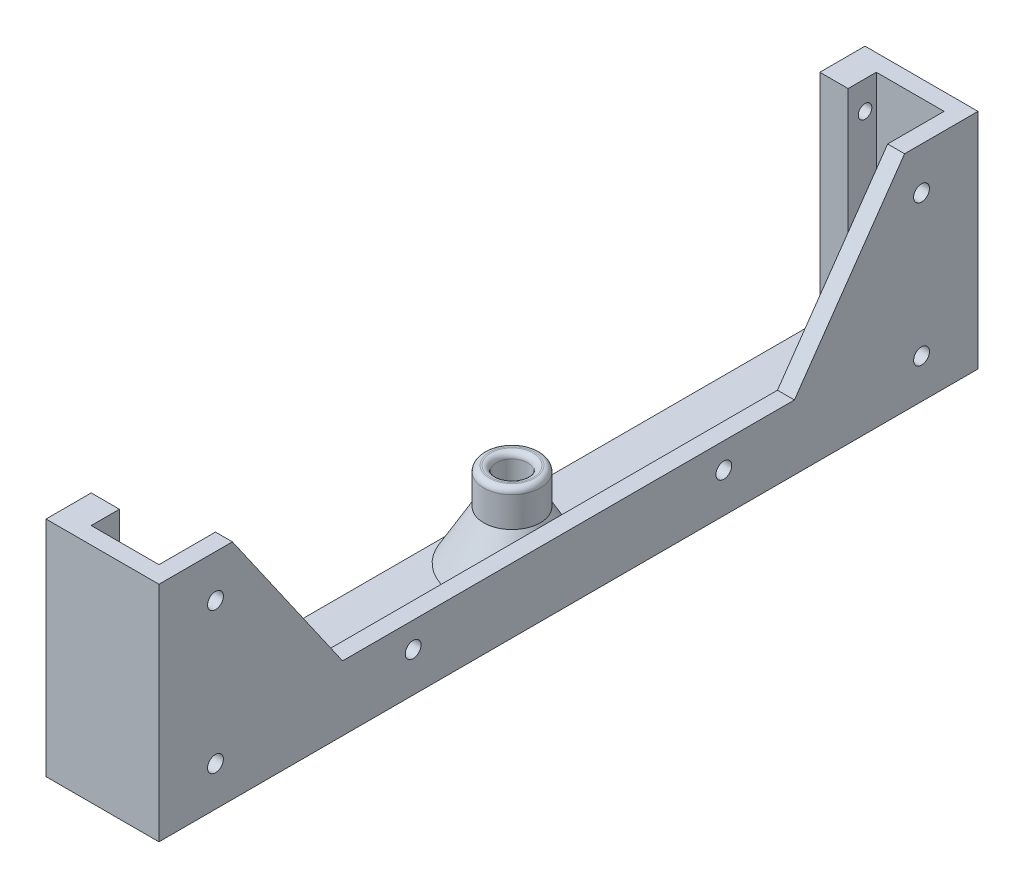
from build123d import *
from OCP.BRepFilletAPI import BRepFilletAPI_MakeChamfer

# Parameters (mm, degrees)
EXTRUDE_1_DEPTH           = 4
SKETCH_2_W                = 6
SKETCH_2_H                = 290
EXTRUDE_2_DEPTH           = 80
EXTRUDE_1_2_DEPTH         = 96
SKETCH_29_W               = 8
SKETCH_29_H               = 100
EXTRUDE_5_DEPTH           = 96
SKETCH_20_W               = 6
SKETCH_20_H               = 7.125217771
SKETCH_20_W_2             = 7.125217771
SKETCH_20_H_2             = 6
SKETCH_20_H_3             = 7.251760651
SKETCH_20_W_3             = 7.251760651
CUT_EXTRUDE_7_DEPTH       = 2
CUT_EXTRUDE_6_DEPTH       = 197.012754687
CUT_EXTRUDE_6_DEPTH_BACK  = 197.012754687
SKETCH_16_R               = 2.8
SKETCH_21_R               = 2
LED_DEPTH                 = 10
SKETCH_22_W               = 46
SKETCH_22_H               = 290
CUT_EXTRUDE_9_DEPTH       = 20
FILLET_3_R                = 30
SKETCH_23_W               = 30
SKETCH_23_H               = 6
EXTRUDE_3_DEPTH           = 10
SKETCH_24_W               = 30
SKETCH_24_H               = 6
EXTRUDE_4_DEPTH           = 10
CHAMFER_1_SIZE            = 10
CUT_EXTRUDE_10_DEPTH      = 10
CHAMFER_2_SIZE            = 2
SKETCH_30_R               = 1.9
CUT_EXTRUDE_11_DEPTH      = 7
SKETCH_32_R               = 1.9
CUT_EXTRUDE_13_DEPTH      = 7
CHAMFER_3_SIZE            = 2
CHAMFER_4_SIZE            = 2
CHAMFER_5_SIZE            = 2
SKETCH_33_R               = 10
EXTRUDE_6_DEPTH           = 30
CHAMFER_6_SIZE            = 10
CHAMFER_6_SIZE_2          = 17.320508076
CUT_EXTRUDE_14_DEPTH      = 171.238068672
CUT_EXTRUDE_14_DEPTH_BACK = 171.238068672
SKETCH_34_R               = 5.5
FILLET_4_R                = 2
CUT_EXTRUDE_15_DEPTH      = 187.077940745
CUT_EXTRUDE_15_DEPTH_BACK = 187.077940745
SKETCH_35_W               = 74.138767557
SKETCH_35_H               = 312.299593446
SKETCH_36_W               = 10
SKETCH_36_H               = 10
EXTRUDE_7_DEPTH           = 76
SKETCH_37_R               = 2.4
CUT_EXTRUDE_16_DEPTH      = 20
CHAMFER_7_SIZE            = 1
CHAMFER_7_SIZE2           = 1.732050808


# Some blends are built 0.0001 mm under size
with BuildPart() as part:
    # Эскиз1 → Extrude 1 (new body)
    with BuildSketch(Plane(origin=(0, 0, 0), x_dir=(1, 0, 0), z_dir=(0, 1, 0))):
        Polygon((-60, -50), (-60, 50), (-20, 145), (20, 145), (20, -145), (-20, -145), align=None)
    extrude(amount=EXTRUDE_1_DEPTH)

    # Эскиз2 → Бобышка-Вытянуть2 (add)
    with BuildSketch(Plane(origin=(0, 0, 0), x_dir=(1, 0, 0), z_dir=(0, 1, 0))):
        with Locations((23, 0)):
            Rectangle(SKETCH_2_W, SKETCH_2_H)
    extrude(amount=EXTRUDE_2_DEPTH)

    # Эскиз17 → Extrude 1 2 (add)
    with BuildSketch(Plane(origin=(0, 4, 0), x_dir=(1, 0, 0), z_dir=(0, 1, 0))):
        Polygon((-20, 145), (-60, 50), (-60, -50), (-20, -145), (26, -145), (26, 145), align=None)
        Polygon((-16.016149012, 139), (-54, 48.788353904), (-54, -48.788353904), (-16.016149012, -139), (20, -139), (20, 139), align=None, mode=Mode.SUBTRACT)
    extrude(amount=EXTRUDE_1_2_DEPTH)

    # Эскиз29 → Бобышка-Вытянуть5 (add)
    with BuildSketch(Plane(origin=(0, 100, 0), x_dir=(1, 0, 0), z_dir=(0, 1, 0))):
        with Locations((-56, 0)):
            Rectangle(SKETCH_29_W, SKETCH_29_H)
    extrude(amount=-EXTRUDE_5_DEPTH)

    # Эскиз20 → Вырез-Вытянуть7 (cut)
    with BuildSketch(Plane(origin=(-52, 0, 0), x_dir=(0, 0, -1), z_dir=(1, 0, 0))):
        Polygon((8.231441461, 94.311267666), (6.387299401, 87.428835803), (12.182854359, 85.875921532), (14.026996418, 92.758353395), align=None)
        with BuildLine():
            Line((6.3, 52), (12.161242978, 57.861242978))
            ThreePointArc((12.161242978, 57.861242978), (0, 65.5), (-12.161242978, 57.861242978))
            Line((-12.161242978, 57.861242978), (-6.3, 52))
            Line((-6.3, 52), (-12.161242978, 46.138757022))
            ThreePointArc((-12.161242978, 46.138757022), (0, 38.5), (12.161242978, 46.138757022))
            Line((12.161242978, 46.138757022), (6.3, 52))
        make_face()
        with Locations((0, 91.437391115)):
            Rectangle(SKETCH_20_W, SKETCH_20_H)
        Polygon((18.901923789, 90.739092363), (15.339314903, 84.568472766), (20.535467326, 81.568472766), (24.098076211, 87.739092363), align=None)
        Polygon((28.284271247, 84.526911935), (23.245981444, 79.488622131), (27.488622131, 75.245981444), (32.526911935, 80.284271247), align=None)
        Polygon((35.739092363, 76.098076211), (29.568472766, 72.535467326), (32.568472766, 67.339314903), (38.739092363, 70.901923789), align=None)
        Polygon((40.758353395, 66.026996418), (33.875921532, 64.182854359), (35.428835803, 58.387299401), (42.311267666, 60.231441461), align=None)
        with Locations((39.437391115, 52)):
            Rectangle(SKETCH_20_W_2, SKETCH_20_H_2)
        Polygon((42.311267666, 43.768558539), (35.428835803, 45.612700599), (33.875921532, 39.817145641), (40.758353395, 37.973003582), align=None)
        Polygon((38.739092363, 33.098076211), (32.568472766, 36.660685097), (29.568472766, 31.464532674), (35.739092363, 27.901923789), align=None)
        Polygon((32.526911935, 23.715728753), (27.488622131, 28.754018556), (23.245981444, 24.511377869), (28.284271247, 19.473088065), align=None)
        Polygon((24.098076211, 16.260907637), (20.535467326, 22.431527234), (15.339314903, 19.431527234), (18.901923789, 13.260907637), align=None)
        Polygon((14.026996418, 11.241646605), (12.182854359, 18.124078468), (6.387299401, 16.571164197), (8.231441461, 9.688732334), align=None)
        with Locations((0, 12.562608886)):
            Rectangle(SKETCH_20_W, SKETCH_20_H)
        Polygon((-8.231441461, 9.688732334), (-6.387299401, 16.571164197), (-12.182854359, 18.124078468), (-14.026996418, 11.241646605), align=None)
        Polygon((-18.901923789, 13.260907637), (-15.339314903, 19.431527234), (-20.535467326, 22.431527234), (-24.098076211, 16.260907637), align=None)
        Polygon((-28.284271247, 19.473088065), (-23.245981444, 24.511377869), (-27.488622131, 28.754018556), (-32.526911935, 23.715728753), align=None)
        Polygon((-35.739092363, 27.901923789), (-29.568472766, 31.464532674), (-32.568472766, 36.660685097), (-38.739092363, 33.098076211), align=None)
        Polygon((-40.758353395, 37.973003582), (-33.875921532, 39.817145641), (-35.428835803, 45.612700599), (-42.311267666, 43.768558539), align=None)
        with Locations((-39.437391115, 52)):
            Rectangle(SKETCH_20_W_2, SKETCH_20_H_2)
        Polygon((-42.311267666, 60.231441461), (-35.428835803, 58.387299401), (-33.875921532, 64.182854359), (-40.758353395, 66.026996418), align=None)
        Polygon((-38.739092363, 70.901923789), (-32.568472766, 67.339314903), (-29.568472766, 72.535467326), (-35.739092363, 76.098076211), align=None)
        Polygon((-32.526911935, 80.284271247), (-27.488622131, 75.245981444), (-23.245981444, 79.488622131), (-28.284271247, 84.526911935), align=None)
        Polygon((-24.098076211, 87.739092363), (-20.535467326, 81.568472766), (-15.339314903, 84.568472766), (-18.901923789, 90.739092363), align=None)
        Polygon((-14.026996418, 92.758353395), (-12.182854359, 85.875921532), (-6.387299401, 87.428835803), (-8.231441461, 94.311267666), align=None)
        Polygon((6.276043463, 68.870426149), (9.901923789, 75.150635095), (15.098076211, 72.150635095), (11.472195886, 65.870426149), align=None)
        with Locations((0, 73.374119675)):
            Rectangle(SKETCH_20_W, SKETCH_20_H_3)
        Polygon((13.870426149, 63.472195886), (20.150635095, 67.098076211), (23.150635095, 61.901923789), (16.870426149, 58.276043463), align=None)
        with Locations((21.374119675, 52)):
            Rectangle(SKETCH_20_W_3, SKETCH_20_H_2)
        Polygon((16.870426149, 45.723956537), (23.150635095, 42.098076211), (20.150635095, 36.901923789), (13.870426149, 40.527804114), align=None)
        Polygon((11.472195886, 38.129573851), (15.098076211, 31.849364905), (9.901923789, 28.849364905), (6.276043463, 35.129573851), align=None)
        with Locations((0, 30.625880326)):
            Rectangle(SKETCH_20_W, SKETCH_20_H_3)
        Polygon((-6.276043463, 35.129573851), (-9.901923789, 28.849364905), (-15.098076211, 31.849364905), (-11.472195886, 38.129573851), align=None)
        Polygon((-13.870426149, 40.527804114), (-20.150635095, 36.901923789), (-23.150635095, 42.098076211), (-16.870426149, 45.723956537), align=None)
        with Locations((-21.374119675, 52)):
            Rectangle(SKETCH_20_W_3, SKETCH_20_H_2)
        Polygon((-16.870426149, 58.276043463), (-23.150635095, 61.901923789), (-20.150635095, 67.098076211), (-13.870426149, 63.472195886), align=None)
        Polygon((-11.472195886, 65.870426149), (-15.098076211, 72.150635095), (-9.901923789, 75.150635095), (-6.276043463, 68.870426149), align=None)
    extrude(amount=-CUT_EXTRUDE_7_DEPTH, mode=Mode.SUBTRACT)

    # Эскиз16 → Вырез-Вытянуть6 (cut, two sides: drawn at the far end of the back side and taken through both)
    with BuildSketch(Plane(origin=(26, 0, 0), x_dir=(0, 0, -1), z_dir=(1, 0, 0)).offset(-CUT_EXTRUDE_6_DEPTH_BACK)):
        with Locations((125, 65)):
            Circle(SKETCH_16_R)
        with Locations((-125, 65)):
            Circle(SKETCH_16_R)
        with Locations((-125, 15)):
            Circle(SKETCH_16_R)
        with Locations((125, 15)):
            Circle(SKETCH_16_R)
        with Locations((55, 15)):
            Circle(SKETCH_16_R)
        with Locations((-55, 15)):
            Circle(SKETCH_16_R)
    extrude(amount=CUT_EXTRUDE_6_DEPTH + CUT_EXTRUDE_6_DEPTH_BACK, mode=Mode.SUBTRACT)

    # Эскиз21 → Отверстия под LED (cut)
    with BuildSketch(Plane(origin=(-52, 0, 0), x_dir=(0, 0, -1), z_dir=(1, 0, 0))):
        with Locations((0, 90.5)):
            Circle(SKETCH_21_R)
        with Locations((9.964533236, 89.188144312)):
            Circle(SKETCH_21_R)
        with Locations((19.25, 85.341978046)):
            Circle(SKETCH_21_R)
        with Locations((27.223611076, 79.223611076)):
            Circle(SKETCH_21_R)
        with Locations((33.341978046, 71.25)):
            Circle(SKETCH_21_R)
        with Locations((37.188144312, 61.964533236)):
            Circle(SKETCH_21_R)
        with Locations((38.5, 52)):
            Circle(SKETCH_21_R)
        with Locations((37.188144312, 42.035466764)):
            Circle(SKETCH_21_R)
        with Locations((33.341978046, 32.75)):
            Circle(SKETCH_21_R)
        with Locations((27.223611076, 24.776388924)):
            Circle(SKETCH_21_R)
        with Locations((19.25, 18.658021954)):
            Circle(SKETCH_21_R)
        with Locations((9.964533236, 14.811855688)):
            Circle(SKETCH_21_R)
        with Locations((0, 13.5)):
            Circle(SKETCH_21_R)
        with Locations((-9.964533236, 14.811855688)):
            Circle(SKETCH_21_R)
        with Locations((-19.25, 18.658021954)):
            Circle(SKETCH_21_R)
        with Locations((-27.223611076, 24.776388924)):
            Circle(SKETCH_21_R)
        with Locations((-33.341978046, 32.75)):
            Circle(SKETCH_21_R)
        with Locations((-37.188144312, 42.035466764)):
            Circle(SKETCH_21_R)
        with Locations((-38.5, 52)):
            Circle(SKETCH_21_R)
        with Locations((-37.188144312, 61.964533236)):
            Circle(SKETCH_21_R)
        with Locations((-33.341978046, 71.25)):
            Circle(SKETCH_21_R)
        with Locations((-27.223611076, 79.223611076)):
            Circle(SKETCH_21_R)
        with Locations((-19.25, 85.341978046)):
            Circle(SKETCH_21_R)
        with Locations((-9.964533236, 89.188144312)):
            Circle(SKETCH_21_R)
        with Locations((0, 73)):
            Circle(SKETCH_21_R)
        with Locations((10.5, 70.186533479)):
            Circle(SKETCH_21_R)
        with Locations((18.186533479, 62.5)):
            Circle(SKETCH_21_R)
        with Locations((21, 52)):
            Circle(SKETCH_21_R)
        with Locations((18.186533479, 41.5)):
            Circle(SKETCH_21_R)
        with Locations((10.5, 33.813466521)):
            Circle(SKETCH_21_R)
        with Locations((0, 31)):
            Circle(SKETCH_21_R)
        with Locations((-10.5, 33.813466521)):
            Circle(SKETCH_21_R)
        with Locations((-18.186533479, 41.5)):
            Circle(SKETCH_21_R)
        with Locations((-21, 52)):
            Circle(SKETCH_21_R)
        with Locations((-18.186533479, 62.5)):
            Circle(SKETCH_21_R)
        with Locations((-10.5, 70.186533479)):
            Circle(SKETCH_21_R)
        with Locations((0, 60.3)):
            Circle(SKETCH_21_R)
        with Locations((7.188010851, 56.15)):
            Circle(SKETCH_21_R)
        with Locations((7.188010851, 47.85)):
            Circle(SKETCH_21_R)
        with Locations((0, 43.7)):
            Circle(SKETCH_21_R)
        with Locations((-7.188010851, 47.85)):
            Circle(SKETCH_21_R)
        with Locations((-7.188010851, 56.15)):
            Circle(SKETCH_21_R)
        with Locations((0, 52)):
            Circle(SKETCH_21_R)
    extrude(amount=-LED_DEPTH, mode=Mode.SUBTRACT)

    # Эскиз22 → Вырез-Вытянуть9 (cut)
    with BuildSketch(Plane(origin=(0, 100, 0), x_dir=(1, 0, 0), z_dir=(0, 1, 0))):
        with Locations((3, 0)):
            Rectangle(SKETCH_22_W, SKETCH_22_H)
    extrude(amount=-CUT_EXTRUDE_9_DEPTH, mode=Mode.SUBTRACT)

    # Скругление3
    # the kernel refuses this fillet: 30 mm, written as the material it takes off along each edge
    with BuildSketch(Plane(origin=(-60, -15.145576201, 50), x_dir=(0, 0, -1), z_dir=(0, 1, 0)), Plane(origin=(-60, 115.145576201, -50), x_dir=(0, 0, 1), z_dir=(0, -1, 0))) as fillet_3_piece_1:
        with BuildLine():
            CenterArc((FILLET_3_R * 0.201941016011, -FILLET_3_R), FILLET_3_R, 90, 22.833654178)
            Line((-FILLET_3_R * 0.186115984047, -FILLET_3_R * 0.0783646248619), (0, 0))
            Line((0, 0), (FILLET_3_R * 0.201941016011, 0))
        make_face()
    extrude(amount=130.291152402, mode=Mode.SUBTRACT)

    # Эскиз23 → Бобышка-Вытянуть3 (add)
    with BuildSketch(Plane(origin=(-63.317246573, 0, -26.659893294), x_dir=(0.38805700005813276, 0, -0.9216353751380653), z_dir=(0.9216353751380653, 0, 0.38805700005813276))):
        with Locations((55.902804754, 97)):
            Rectangle(SKETCH_23_W, SKETCH_23_H)
    extrude(amount=EXTRUDE_3_DEPTH)

    # Эскиз24 → Бобышка-Вытянуть4 (add)
    with BuildSketch(Plane(origin=(-63.317246573, 0, 26.659893294), x_dir=(-0.3880570000581327, 0, -0.9216353751380654), z_dir=(0.9216353751380654, 0, -0.3880570000581327))):
        with Locations((-55.902804754, 97)):
            Rectangle(SKETCH_24_W, SKETCH_24_H)
    extrude(amount=EXTRUDE_4_DEPTH)

    # Фаска1
    chamfer_1_edges = [part.edges().sort_by_distance(p)[0] for p in [
        (-41.623771865, 94, -78.181895724),
        (-41.623771865, 94, 78.181895724),
    ]]
    chamfer(chamfer_1_edges, length=CHAMFER_1_SIZE - 0.0001)  # a hair under: the kernel refuses the full size

    # Эскиз27 → Вырез-Вытянуть10 (cut)
    with BuildSketch(Plane(origin=(26, 0, 0), x_dir=(0, 0, -1), z_dir=(1, 0, 0))):
        Polygon((-80, 24), (80, 24), (119, 80), (-119, 80), align=None)
    extrude(amount=-CUT_EXTRUDE_10_DEPTH, mode=Mode.SUBTRACT)

    # Фаска2
    chamfer_2_edges = [part.edges().sort_by_distance(p)[0] for p in [
        (-60, 32.75, 35.341978046),
        (-60, 42.035466764, 39.188144312),
        (-60, 52, 40.5),
        (-60, 61.964533236, 39.188144312),
        (-60, 71.25, 35.341978046),
        (-60, 79.223611076, 29.223611076),
        (-60, 85.341978046, 21.25),
        (-60, 89.188144312, 11.964533236),
        (-60, 24.776388924, 29.223611076),
        (-60, 18.658021954, 21.25),
        (-60, 14.811855688, 11.964533236),
        (-60, 13.5, 2),
        (-60, 14.811855688, -7.964533236),
        (-60, 18.658021954, -17.25),
        (-60, 24.776388924, -25.223611076),
        (-60, 32.75, -31.341978046),
        (-60, 42.035466764, -35.188144312),
        (-60, 52, -36.5),
        (-60, 61.964533236, -35.188144312),
        (-60, 71.25, -31.341978046),
        (-60, 79.223611076, -25.223611076),
        (-60, 85.341978046, -17.25),
        (-60, 89.188144312, -7.964533236),
        (-60, 90.5, 2),
    ]]
    chamfer(chamfer_2_edges, length=CHAMFER_2_SIZE)

    # Эскиз30 → Вырез-Вытянуть11 (cut)
    with BuildSketch(Plane(origin=(-52, 0, 0), x_dir=(0, 0, -1), z_dir=(1, 0, 0))):
        with Locations((-40, 92)):
            Circle(SKETCH_30_R)
        with Locations((40, 92)):
            Circle(SKETCH_30_R)
        with Locations((-40, 12)):
            Circle(SKETCH_30_R)
        with Locations((40, 12)):
            Circle(SKETCH_30_R)
    extrude(amount=-CUT_EXTRUDE_11_DEPTH, mode=Mode.SUBTRACT)

    # Эскиз32 → Вырез-Вытянуть13 (cut)
    with BuildSketch(Plane(origin=(0, 100, 0), x_dir=(1, 0, 0), z_dir=(0, 1, 0))):
        with Locations(Location((-38, 77.261926747, 0), (0, 0, 270))):
            Circle(SKETCH_32_R)
        with Locations(Location((-38, -77.261926747, 0), (0, 0, 90))):
            Circle(SKETCH_32_R)
    extrude(amount=-CUT_EXTRUDE_13_DEPTH, mode=Mode.SUBTRACT)

    # Фаска3
    chamfer_3_edges = [part.edges().sort_by_distance(p)[0] for p in [
        (-60, 60.3, 2),
        (-60, 56.15, 9.188010851),
        (-60, 47.85, 9.188010851),
        (-60, 43.7, 2),
        (-60, 47.85, -5.188010851),
        (-60, 56.15, -5.188010851),
        (-60, 52, 2),
    ]]
    chamfer(chamfer_3_edges, length=CHAMFER_3_SIZE)

    # Фаска4
    chamfer_4_edges = [part.edges().sort_by_distance(p)[0] for p in [
        (-60, 70.186533479, -8.5),
        (-60, 62.5, -16.186533479),
        (-60, 52, -19),
        (-60, 41.5, -16.186533479),
        (-60, 33.813466521, -8.5),
        (-60, 31, 2),
        (-60, 33.813466521, 12.5),
        (-60, 73, 2),
        (-60, 70.186533479, 12.5),
        (-60, 62.5, 20.186533479),
        (-60, 52, 23),
        (-60, 41.5, 20.186533479),
    ]]
    chamfer(chamfer_4_edges, length=CHAMFER_4_SIZE)

    # Фаска5
    chamfer_5_edges = [part.edges().sort_by_distance(p)[0] for p in [
        (20, 65, 127.8),
        (20, 15, 127.8),
        (20, 15, -122.2),
        (20, 15, -52.2),
        (20, 15, 57.8),
        (20, 65, -122.2),
    ]]
    chamfer(chamfer_5_edges, length=CHAMFER_5_SIZE)

    # Эскиз33 → Бобышка-Вытянуть6 (add)
    with BuildSketch(Plane(origin=(0, 4, 0), x_dir=(1, 0, 0), z_dir=(0, 1, 0))):
        with Locations(Location((6, 0, 0), (0, 0, 90))):
            Circle(SKETCH_33_R)
    extrude(amount=EXTRUDE_6_DEPTH)

    # Фаска6
    # the kernel refuses this chamfer: 17.320508076, 10 mm, written as the material it adds along each edge
    with BuildSketch(Plane(origin=(6, 4, 0), x_dir=(0, 0, -1), z_dir=(1, 0, 0))) as chamfer_6_piece_1:
        Polygon((10 + CHAMFER_6_SIZE, 0), (10, CHAMFER_6_SIZE_2), (10, 0), align=None)
    revolve(axis=Axis((6, 4, 0), (0, 1, 0)))

    # Эскиз34 → Вырез-Вытянуть14 (cut, two sides: drawn at the far end of the back side and taken through both)
    with BuildSketch(Plane(origin=(0, 34, 0), x_dir=(1, 0, 0), z_dir=(0, 1, 0)).offset(-CUT_EXTRUDE_14_DEPTH_BACK)):
        with Locations(Location((6, 0, 0), (0, 0, 270))):
            Circle(SKETCH_34_R)
    extrude(amount=CUT_EXTRUDE_14_DEPTH + CUT_EXTRUDE_14_DEPTH_BACK, mode=Mode.SUBTRACT)

    # Скругление4
    fillet_4_edges = [part.edges().sort_by_distance(p)[0] for p in [
        (6, 34, 10),
        (6, 34, -5.5),
    ]]
    fillet(fillet_4_edges, radius=FILLET_4_R)

    # Эскиз35 → Вырез-Вытянуть15 (cut, two sides: drawn at the far end of the back side and taken through both)
    with BuildSketch(Plane(origin=(0, 100, 0), x_dir=(1, 0, 0), z_dir=(0, 1, 0)).offset(-CUT_EXTRUDE_15_DEPTH_BACK)):
        with Locations((-51.069383779, 0)):
            Rectangle(SKETCH_35_W, SKETCH_35_H)
    extrude(amount=CUT_EXTRUDE_15_DEPTH + CUT_EXTRUDE_15_DEPTH_BACK, mode=Mode.SUBTRACT)

    # Эскиз36 → Бобышка-Вытянуть7 (add)
    with BuildSketch(Plane(origin=(0, 4, 0), x_dir=(1, 0, 0), z_dir=(0, 1, 0))):
        with Locations((-9, 134)):
            Rectangle(SKETCH_36_W, SKETCH_36_H)
        with Locations((-9, -134)):
            Rectangle(SKETCH_36_W, SKETCH_36_H)
    extrude(amount=EXTRUDE_7_DEPTH)

    # Эскиз37 → Вырез-Вытянуть16 (cut)
    with BuildSketch(Plane.ZY.offset(14)):
        with Locations((-135, 70)):
            Circle(SKETCH_37_R)
        with Locations((-135, 10)):
            Circle(SKETCH_37_R)
        with Locations((135, 10)):
            Circle(SKETCH_37_R)
        with Locations((135, 70)):
            Circle(SKETCH_37_R)
    extrude(amount=-CUT_EXTRUDE_16_DEPTH, mode=Mode.SUBTRACT)

    # Фаска7: one chamfer whose edges measure the first distance from different faces: ONE call of the kernel's chamfer builder (chamfer() names one face for all edges)
    chamfer_7_edges_1 = [part.edges().sort_by_distance(p)[0] for p in [
        (6, 0, -5.5),
    ]]
    chamfer_7_side_1 = [part.faces().sort_by_distance(p)[0] for p in [
        (6, 16, -5.5),
    ]]
    chamfer_7_edges_2 = [part.edges().sort_by_distance(p)[0] for p in [
        (6, 0, 145),
    ]]
    chamfer_7_side_2 = [part.faces().sort_by_distance(p)[0] for p in [
        (6, 40, 145),
    ]]
    chamfer_7_edges_3 = [part.edges().sort_by_distance(p)[0] for p in [
        (-14, 0, 0),
    ]]
    chamfer_7_side_3 = [part.faces().sort_by_distance(p)[0] for p in [
        (-14, 76.991678209, 137),
    ]]
    chamfer_7_edges_4 = [part.edges().sort_by_distance(p)[0] for p in [
        (26, 0, 0),
    ]]
    chamfer_7_side_4 = [part.faces().sort_by_distance(p)[0] for p in [
        (26, 3.008321791, 0),
    ]]
    chamfer_7_edges_5 = [part.edges().sort_by_distance(p)[0] for p in [
        (6, 0, -145),
    ]]
    chamfer_7_side_5 = [part.faces().sort_by_distance(p)[0] for p in [
        (6, 40, -145),
    ]]
    chamfer_7 = BRepFilletAPI_MakeChamfer(part.part.solid().wrapped)
    for e in chamfer_7_edges_1:
        chamfer_7.Add(CHAMFER_7_SIZE, CHAMFER_7_SIZE2, e.wrapped, chamfer_7_side_1[0].wrapped)  # the first distance lies on this face
    for e in chamfer_7_edges_2:
        chamfer_7.Add(CHAMFER_7_SIZE, CHAMFER_7_SIZE2, e.wrapped, chamfer_7_side_2[0].wrapped)  # the first distance lies on this face
    for e in chamfer_7_edges_3:
        chamfer_7.Add(CHAMFER_7_SIZE, CHAMFER_7_SIZE2, e.wrapped, chamfer_7_side_3[0].wrapped)  # the first distance lies on this face
    for e in chamfer_7_edges_4:
        chamfer_7.Add(CHAMFER_7_SIZE, CHAMFER_7_SIZE2, e.wrapped, chamfer_7_side_4[0].wrapped)  # the first distance lies on this face
    for e in chamfer_7_edges_5:
        chamfer_7.Add(CHAMFER_7_SIZE, CHAMFER_7_SIZE2, e.wrapped, chamfer_7_side_5[0].wrapped)  # the first distance lies on this face
    add(Compound.cast(chamfer_7.Shape()), mode=Mode.REPLACE)


solid = part.part
